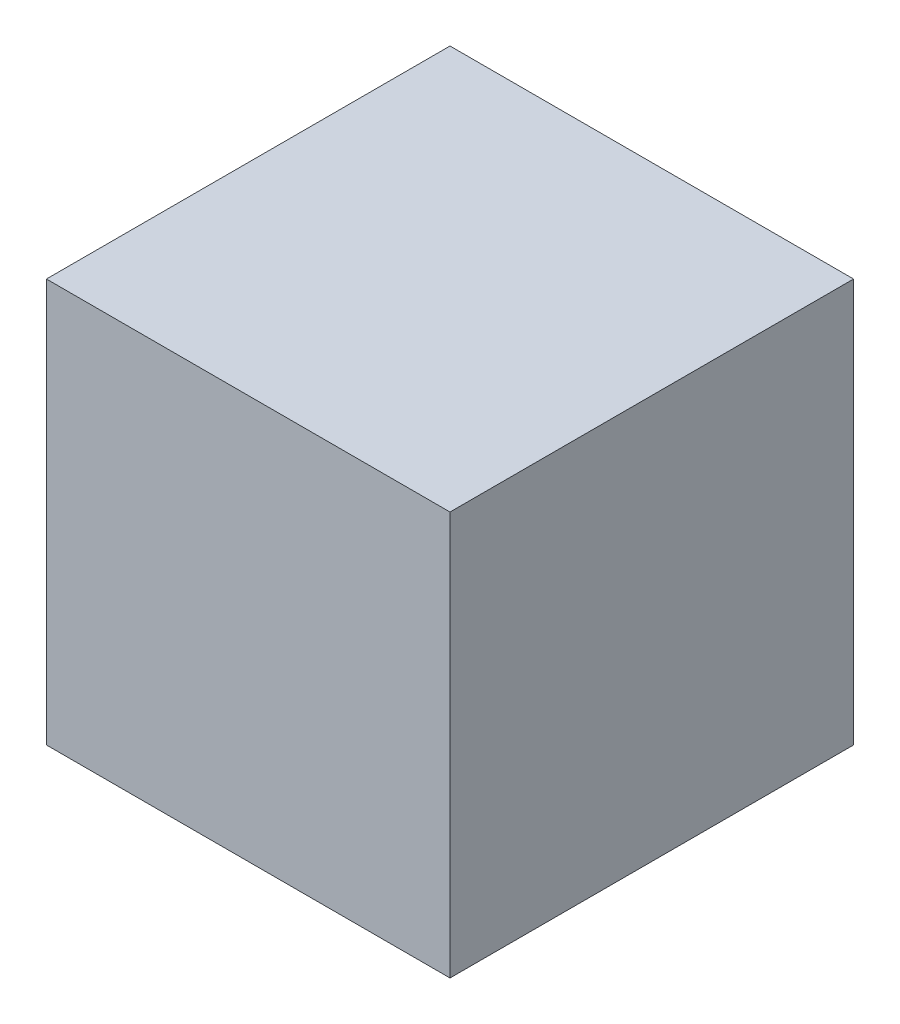
from build123d import *

# Parameters (mm, degrees)
SKETCH1_W           = 3.175
SKETCH1_H           = 3.175
BOSS_EXTRUDE1_DEPTH = 3.175


with BuildPart() as part:
    # Sketch1 → Boss-Extrude1 (new body)
    with BuildSketch(Plane(origin=(0, 0, 0), x_dir=(1, 0, 0), z_dir=(0, 1, 0))):
        Rectangle(SKETCH1_W, SKETCH1_H)
    extrude(amount=BOSS_EXTRUDE1_DEPTH)


solid = part.part
